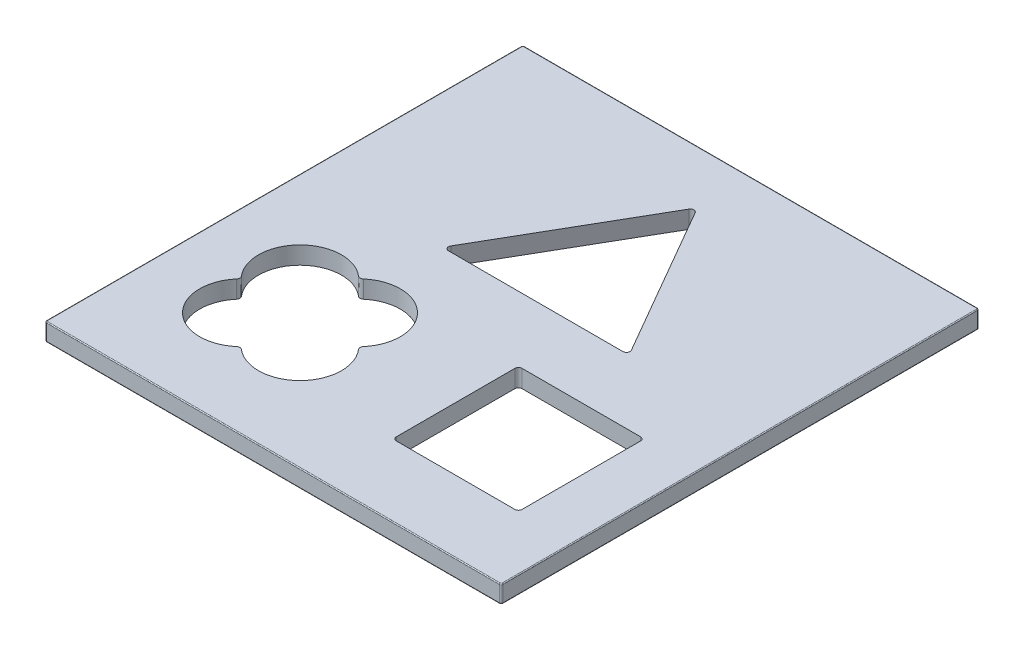
from build123d import *

# Parameters (mm, degrees)
BOSS_EXTRUDE2_DEPTH = 4.9
FILLET2_R           = 0.25
CUT_EXTRUDE1_DEPTH  = 93.078825


with BuildPart() as part:
    # Sketch1 → Boss-Extrude2 (new body)
    with BuildSketch(Plane(origin=(0, 0, 0), x_dir=(1, 0, 0), z_dir=(0, 1, 0))):
        with BuildLine():
            Line((-63, 66.5), (63, 66.5))
            ThreePointArc((63, 66.5), (63.353553391, 66.353553391), (63.5, 66))
            Line((63.5, 66), (63.5, -66))
            ThreePointArc((63.5, -66), (63.353553391, -66.353553391), (63, -66.5))
            Line((63, -66.5), (-63, -66.5))
            ThreePointArc((-63, -66.5), (-63.353553391, -66.353553391), (-63.5, -66))
            Line((-63.5, -66), (-63.5, 66))
            ThreePointArc((-63.5, 66), (-63.353553391, 66.353553391), (-63, 66.5))
        make_face()
    extrude(amount=BOSS_EXTRUDE2_DEPTH)

    # Fillet2
    fillet2_edges = [part.edges().sort_by_distance(p)[0] for p in [
        (-63.5, 0, 0),
        (-63.353553391, 0, 66.353553391),
        (0, 0, 66.5),
        (63.353553391, 0, 66.353553391),
        (63.5, 0, 0),
        (63.353553391, 0, -66.353553391),
        (0, 0, -66.5),
        (-63.353553391, 0, -66.353553391),
        (0, 4.9, -66.5),
        (63.353553391, 4.9, -66.353553391),
        (63.5, 4.9, 0),
        (63.353553391, 4.9, 66.353553391),
        (0, 4.9, 66.5),
        (-63.353553391, 4.9, 66.353553391),
        (-63.5, 4.9, 0),
        (-63.353553391, 4.9, -66.353553391),
    ]]
    fillet(fillet2_edges, radius=FILLET2_R)

    # Sketch3 → Cut-Extrude1 (cut, through all)
    with BuildSketch(Plane(origin=(0, 4.9, 0), x_dir=(1, 0, 0), z_dir=(0, 1, 0))):
        with BuildLine():
            Line((-0.866025404, 50.12), (-25.133974596, 8.086679003))
            ThreePointArc((-25.133974596, 8.086679003), (-25.133974596, 7.086679003), (-24.267949192, 6.586679003))
            Line((-24.267949192, 6.586679003), (24.267949192, 6.586679003))
            ThreePointArc((24.267949192, 6.586679003), (25.133974596, 7.086679003), (25.133974596, 8.086679003))
            Line((25.133974596, 8.086679003), (0.866025404, 50.12))
            ThreePointArc((0.866025404, 50.12), (0, 50.62), (-0.866025404, 50.12))
        make_face()
        with BuildLine():
            Line((14.3, -11.5), (47.3, -11.5))
            ThreePointArc((47.3, -11.5), (48.007106781, -11.792893219), (48.3, -12.5))
            Line((48.3, -12.5), (48.3, -45.5))
            ThreePointArc((48.3, -45.5), (48.007106781, -46.207106781), (47.3, -46.5))
            Line((47.3, -46.5), (14.3, -46.5))
            ThreePointArc((14.3, -46.5), (13.592893219, -46.207106781), (13.3, -45.5))
            Line((13.3, -45.5), (13.3, -12.5))
            ThreePointArc((13.3, -12.5), (13.592893219, -11.792893219), (14.3, -11.5))
        make_face()
        with BuildLine():
            ThreePointArc((-13.047253702, -28.349154498), (-13.65, -12.64), (-29.359154498, -12.037253702))
            ThreePointArc((-29.359154498, -12.037253702), (-30.01, -12.278043498), (-30.660845502, -12.037253702))
            ThreePointArc((-30.660845502, -12.037253702), (-46.37, -12.64), (-46.972746298, -28.349154498))
            ThreePointArc((-46.972746298, -28.349154498), (-46.731956502, -29), (-46.972746298, -29.650845502))
            ThreePointArc((-46.972746298, -29.650845502), (-46.37, -45.36), (-30.660845502, -45.962746298))
            ThreePointArc((-30.660845502, -45.962746298), (-30.01, -45.721956502), (-29.359154498, -45.962746298))
            ThreePointArc((-29.359154498, -45.962746298), (-13.65, -45.36), (-13.047253702, -29.650845502))
            ThreePointArc((-13.047253702, -29.650845502), (-13.288043498, -29), (-13.047253702, -28.349154498))
        make_face()
    extrude(amount=-CUT_EXTRUDE1_DEPTH, mode=Mode.SUBTRACT)


solid = part.part
